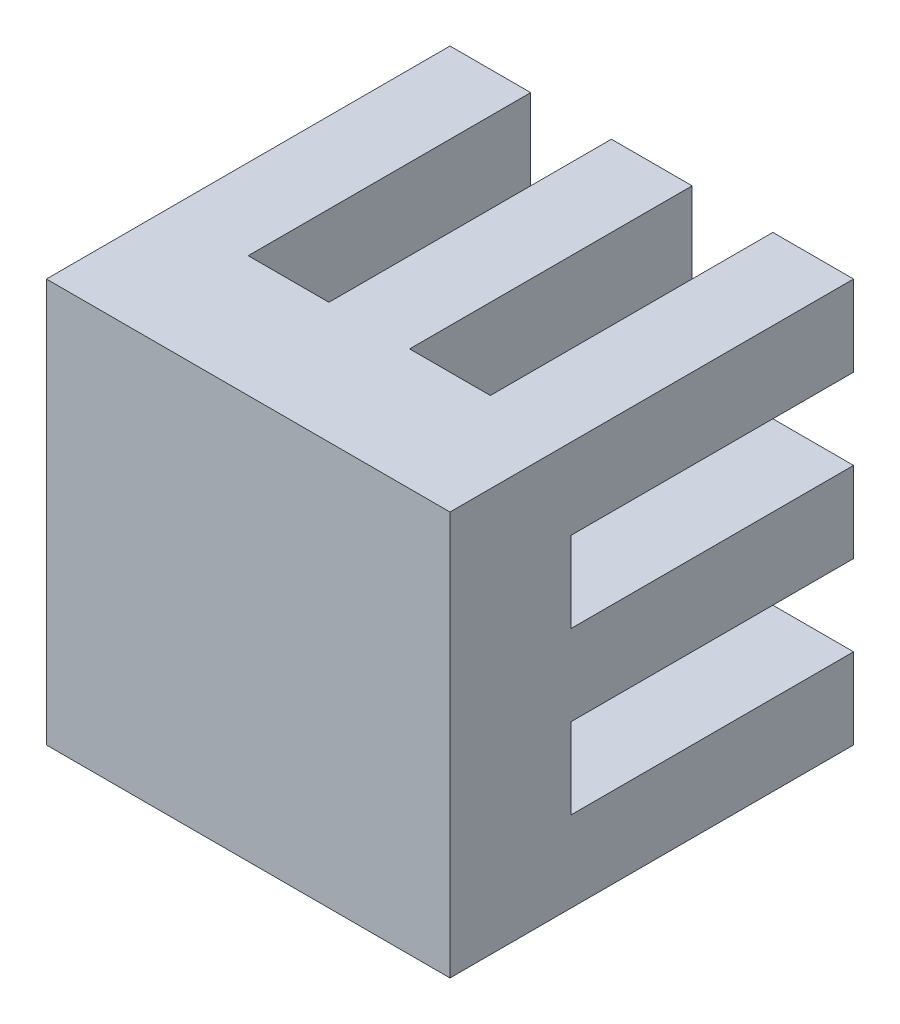
from build123d import *

# Parameters (mm, degrees)
SKETCH_1_W             = 10
SKETCH_1_H             = 10
EXTRUDE_1_DEPTH        = 10
SKETCH_2_W             = 2
SKETCH_2_H             = 7
CUT_EXTRUDE_1_DEPTH    = 10
PATTERN_LINEAR_1_COUNT = 2
PATTERN_LINEAR_1_PITCH = 4
SKETCH_3_W             = 10
SKETCH_3_H             = 2
CUT_EXTRUDE_2_DEPTH    = 7
PATTERN_LINEAR_3_COUNT = 2
PATTERN_LINEAR_3_PITCH = 4


with BuildPart() as part:
    # 草图1 → 凸台-拉伸1 (new body)
    with BuildSketch(Plane(origin=(0, 0, 0), x_dir=(1, 0, 0), z_dir=(0, 1, 0))):
        with Locations((5, -5)):
            Rectangle(SKETCH_1_W, SKETCH_1_H)
    extrude(amount=EXTRUDE_1_DEPTH)

    # 草图2 → 切除-拉伸1 (cut)
    with BuildSketch(Plane(origin=(0, 10, 0), x_dir=(1, 0, 0), z_dir=(0, 1, 0))):
        with Locations((3, -3.5)):
            Rectangle(SKETCH_2_W, SKETCH_2_H)
    cut_extrude_1 = extrude(amount=-CUT_EXTRUDE_1_DEPTH, mode=Mode.SUBTRACT)

    # 阵列(线性)1: 切除-拉伸1 ×2
    with Locations(*[(i * PATTERN_LINEAR_1_PITCH, 0, 0) for i in range(1, PATTERN_LINEAR_1_COUNT)]):
        add(cut_extrude_1, mode=Mode.SUBTRACT)

    # 草图3 → 切除-拉伸2 (cut)
    with BuildSketch(Plane(origin=(0, 0, 0), x_dir=(-1, 0, 0), z_dir=(0, 0, -1))):
        with Locations((-5, 3)):
            Rectangle(SKETCH_3_W, SKETCH_3_H)
    cut_extrude_2 = extrude(amount=-CUT_EXTRUDE_2_DEPTH, mode=Mode.SUBTRACT)

    # 阵列(线性)3: 切除-拉伸2 ×2
    with Locations(*[(0, i * PATTERN_LINEAR_3_PITCH, 0) for i in range(1, PATTERN_LINEAR_3_COUNT)]):
        add(cut_extrude_2, mode=Mode.SUBTRACT)


solid = part.part
